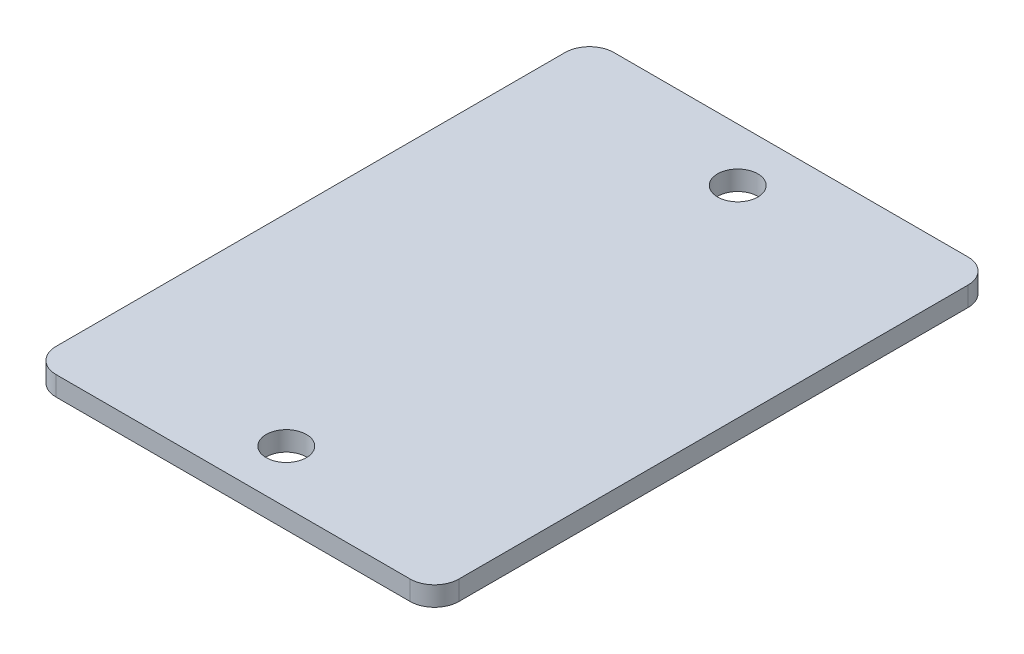
from build123d import *

# Parameters (mm, degrees)
SKETCH1_W           = 33.02
SKETCH1_H           = 45.72
SKETCH1_R           = 1.65
BOSS_EXTRUDE1_DEPTH = 1.6
FILLET1_R           = 2


with BuildPart() as part:
    # Sketch1 → Boss-Extrude1 (new body)
    with BuildSketch(Plane(origin=(0, 0, 0), x_dir=(1, 0, 0), z_dir=(0, 1, 0))):
        Rectangle(SKETCH1_W, SKETCH1_H)
        with Locations((0, 18.5)):
            Circle(SKETCH1_R, mode=Mode.SUBTRACT)
        with Locations((0, -18.5)):
            Circle(SKETCH1_R, mode=Mode.SUBTRACT)
    extrude(amount=BOSS_EXTRUDE1_DEPTH)

    # Fillet1
    fillet1_edges = [part.edges().sort_by_distance(p)[0] for p in [
        (-16.51, 0.8, 22.86),
        (16.51, 0.8, 22.86),
        (16.51, 0.8, -22.86),
        (-16.51, 0.8, -22.86),
    ]]
    fillet(fillet1_edges, radius=FILLET1_R)


solid = part.part
